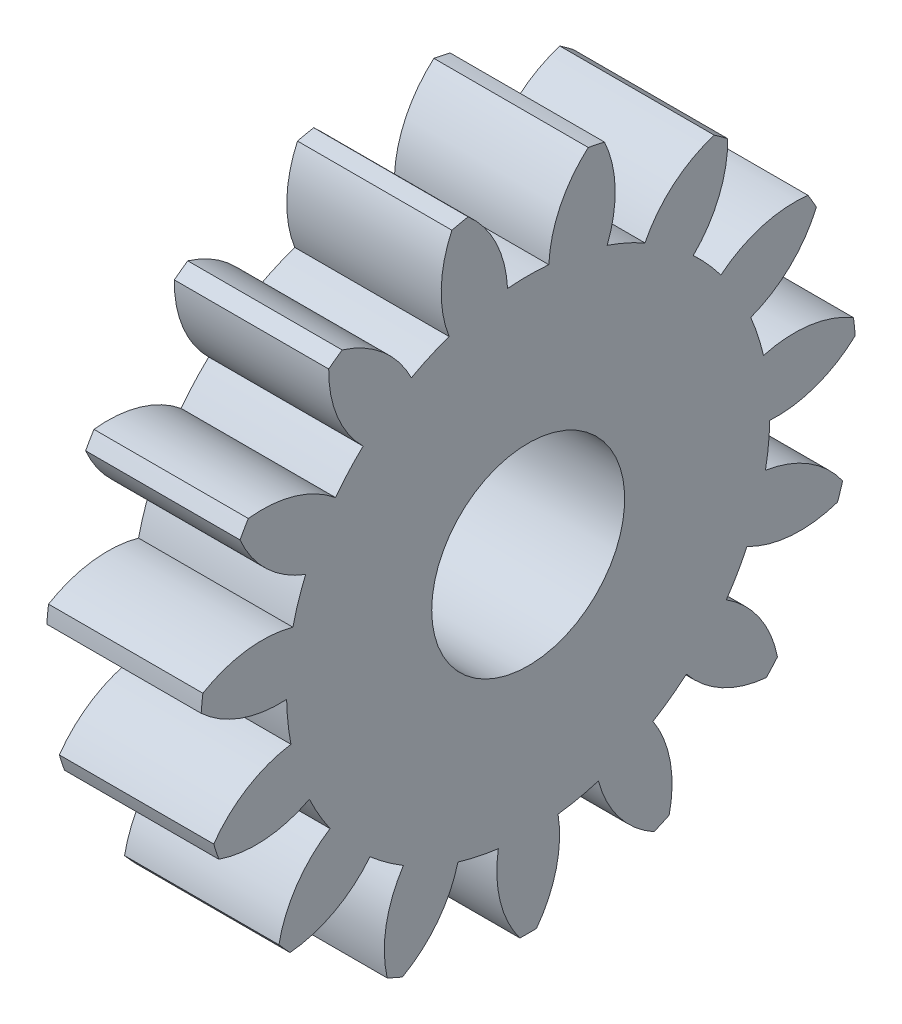
from build123d import *

# Parameters (mm, degrees)
SPUR_START             = -16.129320455
SPUR_GEAR_AI_OUTLINE_R = 3.175
SPUR_GEAR_AI_DEPTH     = 5.08
SCALE1_SCALE           = 15


# Read off the part's stored shape, not the designer's step: spur gear_ai
with BuildPart() as part:
    # spur gear_ai outline → spur gear_ai (new body)
    with BuildSketch(Plane.YZ.offset(SPUR_START)):
        with BuildLine():
            ThreePointArc((3.217647432, 17.980210444), (2.945962103, 18.012251215), (2.673552099, 18.037397168))
            ThreePointArc((2.673552099, 18.037397168), (1.882282705, 16.734209467), (1.665300635, 15.22512888))
            ThreePointArc((1.665300635, 15.22512888), (0.986555153, 15.183035327), (0.313890146, 15.083089914))
            ThreePointArc((0.313890146, 15.083089914), (-0.212105842, 16.514080361), (-1.257032059, 17.624276126))
            ThreePointArc((-1.257032059, 17.624276126), (-1.518261113, 17.543042448), (-1.777347815, 17.455215289))
            ThreePointArc((-1.777347815, 17.455215289), (-1.970154185, 15.942855827), (-1.554578797, 14.475987553))
            ThreePointArc((-1.554578797, 14.475987553), (-2.157522658, 14.161462519), (-2.731381258, 13.796560335))
            ThreePointArc((-2.731381258, 13.796560335), (-3.793938754, 14.889893315), (-5.200083652, 15.479097832))
            ThreePointArc((-5.200083652, 15.479097832), (-5.405687554, 15.298635745), (-5.60665251, 15.113021587))
            ThreePointArc((-5.60665251, 15.113021587), (-5.167657883, 13.652991056), (-4.191381798, 12.481969945))
            ThreePointArc((-4.191381798, 12.481969945), (-4.614269567, 11.949397667), (-4.990096395, 11.382633613))
            ThreePointArc((-4.990096395, 11.382633613), (-6.405489555, 11.949261922), (-7.929717906, 11.915596376))
            ThreePointArc((-7.929717906, 11.915596376), (-8.044145874, 11.667109416), (-8.152240417, 11.415802634))
            ThreePointArc((-8.152240417, 11.415802634), (-7.157350952, 10.260553574), (-5.789181173, 9.587859815))
            ThreePointArc((-5.789181173, 9.587859815), (-5.958891714, 8.929326879), (-6.071702896, 8.25869961))
            ThreePointArc((-6.071702896, 8.25869961), (-7.595197385, 8.200648065), (-8.973956261, 7.549933535))
            ThreePointArc((-8.973956261, 7.549933535), (-8.977422659, 7.276387354), (-8.973956261, 7.002841173))
            ThreePointArc((-8.973956261, 7.002841173), (-7.595197384, 6.352126644), (-6.071702896, 6.294075099))
            ThreePointArc((-6.071702896, 6.294075099), (-5.958891714, 5.62344783), (-5.789181173, 4.964914893))
            ThreePointArc((-5.789181173, 4.964914893), (-7.157350952, 4.292221134), (-8.152240417, 3.136972074))
            ThreePointArc((-8.152240417, 3.136972074), (-8.044145874, 2.885665292), (-7.929717906, 2.637178332))
            ThreePointArc((-7.929717906, 2.637178332), (-6.405489555, 2.603512786), (-4.990096395, 3.170141095))
            ThreePointArc((-4.990096395, 3.170141095), (-4.614269567, 2.603377042), (-4.191381798, 2.070804764))
            ThreePointArc((-4.191381798, 2.070804764), (-5.167657883, 0.899783653), (-5.60665251, -0.560246879))
            ThreePointArc((-5.60665251, -0.560246879), (-5.405687554, -0.745861037), (-5.200083652, -0.926323123))
            ThreePointArc((-5.200083652, -0.926323123), (-3.793938754, -0.337118607), (-2.731381258, 0.756214373))
            ThreePointArc((-2.731381258, 0.756214373), (-2.157522658, 0.391312189), (-1.554578797, 0.076787156))
            ThreePointArc((-1.554578797, 0.076787156), (-1.970154185, -1.390081118), (-1.777347815, -2.90244058))
            ThreePointArc((-1.777347815, -2.90244058), (-1.518261113, -2.990267739), (-1.257032059, -3.071501418))
            ThreePointArc((-1.257032059, -3.071501418), (-0.212105842, -1.961305652), (0.313890146, -0.530315206))
            ThreePointArc((0.313890146, -0.530315206), (0.986555153, -0.630260618), (1.665300635, -0.672354172))
            ThreePointArc((1.665300635, -0.672354172), (1.882282705, -2.181434759), (2.673552099, -3.48462246))
            ThreePointArc((2.673552099, -3.48462246), (2.945962103, -3.459476506), (3.217647432, -3.427435736))
            ThreePointArc((3.217647432, -3.427435736), (3.720677732, -1.988211655), (3.619162727, -0.466994991))
            ThreePointArc((3.619162727, -0.466994991), (4.27432425, -0.284702162), (4.911510093, -0.047085877))
            ThreePointArc((4.911510093, -0.047085877), (5.723531449, -1.337445034), (6.976446201, -2.206127982))
            ThreePointArc((6.976446201, -2.206127982), (7.215077342, -2.07235688), (7.450242085, -1.932581801))
            ThreePointArc((7.450242085, -1.932581801), (7.324397959, -0.413184324), (6.612924828, 0.935226378))
            ThreePointArc((6.612924828, 0.935226378), (7.137299488, 1.368237363), (7.62275047, 1.844477471))
            ThreePointArc((7.62275047, 1.844477471), (8.889405244, 0.995954565), (10.38732501, 0.711979544))
            ThreePointArc((10.38732501, 0.711979544), (10.550915796, 0.931245556), (10.708897832, 1.154586562))
            ThreePointArc((10.708897832, 1.154586562), (9.975938874, 2.491439809), (8.777527784, 3.433892087))
            ThreePointArc((8.777527784, 3.433892087), (9.080446439, 4.042749694), (9.330223676, 4.675267385))
            ThreePointArc((9.330223676, 4.675267385), (10.832495749, 4.415298049), (12.316416594, 4.765132816))
            ThreePointArc((12.316416594, 4.765132816), (12.376680691, 5.031980652), (12.430163492, 5.300269897))
            ThreePointArc((12.430163492, 5.300269897), (11.216824963, 6.223424842), (9.73869208, 6.596960136))
            ThreePointArc((9.73869208, 6.596960136), (9.767777341, 7.276387354), (9.73869208, 7.955814572))
            ThreePointArc((9.73869208, 7.955814572), (11.216824963, 8.329349866), (12.430163492, 9.252504811))
            ThreePointArc((12.430163492, 9.252504811), (12.376680691, 9.520794056), (12.316416594, 9.787641893))
            ThreePointArc((12.316416594, 9.787641893), (10.832495749, 10.137476659), (9.330223676, 9.877507324))
            ThreePointArc((9.330223676, 9.877507324), (9.080446439, 10.510025014), (8.777527784, 11.118882621))
            ThreePointArc((8.777527784, 11.118882621), (9.975938874, 12.061334899), (10.708897832, 13.398188146))
            ThreePointArc((10.708897832, 13.398188146), (10.550915796, 13.621529153), (10.38732501, 13.840795164))
            ThreePointArc((10.38732501, 13.840795164), (8.889405244, 13.556820143), (7.62275047, 12.708297238))
            ThreePointArc((7.62275047, 12.708297238), (7.137299488, 13.184537346), (6.612924828, 13.61754833))
            ThreePointArc((6.612924828, 13.61754833), (7.324397959, 14.965959032), (7.450242085, 16.485356509))
            ThreePointArc((7.450242085, 16.485356509), (7.215077342, 16.625131588), (6.976446201, 16.75890269))
            ThreePointArc((6.976446201, 16.75890269), (5.723531449, 15.890219742), (4.911510093, 14.599860585))
            ThreePointArc((4.911510093, 14.599860585), (4.27432425, 14.83747687), (3.619162727, 15.019769699))
            ThreePointArc((3.619162727, 15.019769699), (3.720677732, 16.540986364), (3.217647432, 17.980210444))
        make_face()
        with Locations((1.817577341, 7.276387354)):
            Circle(SPUR_GEAR_AI_OUTLINE_R, mode=Mode.SUBTRACT)
    extrude(amount=SPUR_GEAR_AI_DEPTH)


with BuildPart() as part_1:
    # Scale1: scaled about (-13.589320455, 1.817577341, 7.276387354)
    add(part.part.scale(SCALE1_SCALE).moved(Location((190.25048637, -25.446082774, -101.869422956))))


solid = part_1.part
